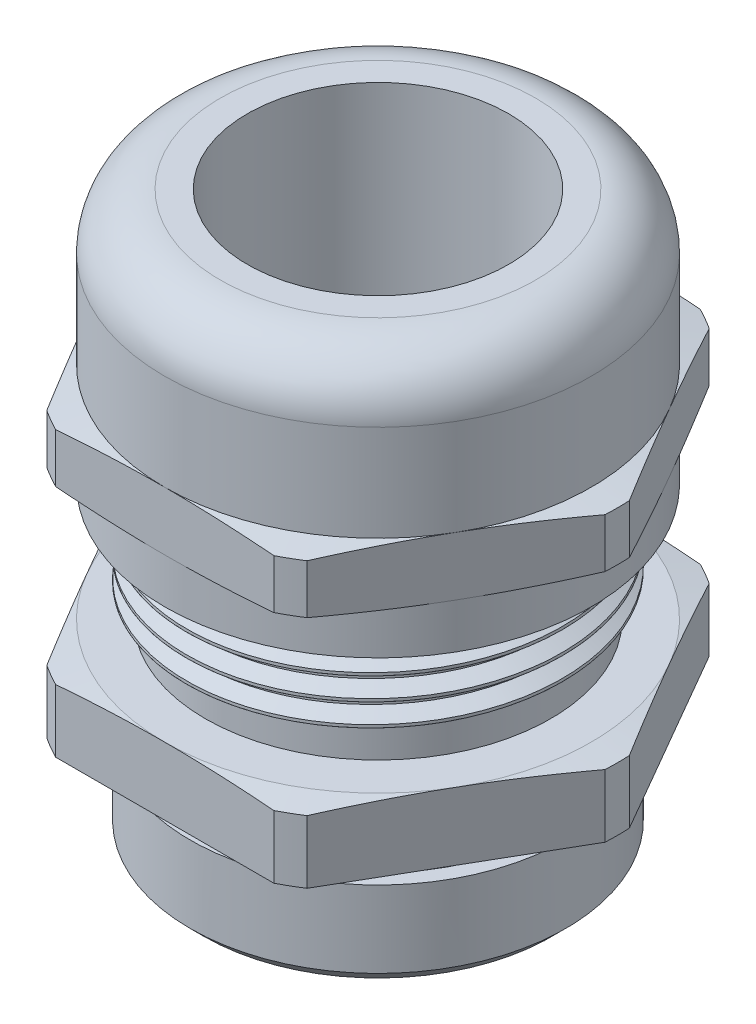
from build123d import *

# Parameters (mm, degrees)
SKETCH2_R        = 33.244454728
EXTRUDE1_DEPTH   = 44.590079147
CHAMFER2_SIZE    = 0.9
CUT_SWEEP1_PITCH = 1.5


with BuildPart() as part:
    # Sketch1 → Revolve1 (revolve)
    with BuildSketch(Plane.XY, mode=Mode.PRIVATE) as revolve1_sk:
        with BuildLine():
            Line((-8.7, 34.639140794), (-10.5, 34.639140794))
            ThreePointArc((-10.5, 34.639140794), (-13.11629509, 33.555435885), (-14.2, 30.939140794))
            Line((-14.2, 30.939140794), (-14.2, 24.539140794))
            Line((-14.2, 24.539140794), (-15.95, 24.230568578))
            Line((-15.95, 24.230568578), (-15.95, 20.947713011))
            Line((-15.95, 20.947713011), (-14.2, 20.639140794))
            Line((-14.2, 20.639140794), (-14.2, 17.639140794))
            Line((-14.2, 17.639140794), (-12.6, 17.639140794))
            Line((-12.6, 17.639140794), (-12.6, 19.639140794))
            Line((-12.6, 19.639140794), (-12.5, 19.639140794))
            Line((-12.5, 19.639140794), (-12.5, 11.839140794))
            Line((-12.5, 11.839140794), (-11.5, 11.839140794))
            Line((-11.5, 11.839140794), (-11.5, 9.839140794))
            Line((-11.5, 9.839140794), (-14.2, 9.839140794))
            Line((-14.2, 9.839140794), (-15.95, 9.530568578))
            Line((-15.95, 9.530568578), (-15.95, 5.339140794))
            Line((-15.95, 5.339140794), (-11.5, 5.339140794))
            Line((-11.5, 5.339140794), (-11.5, 3.339140794))
            Line((-11.5, 3.339140794), (-12.5, 3.339140794))
            Line((-12.5, 3.339140794), (-12.5, -2.660859206))
            Line((-12.5, -2.660859206), (-10, -2.660859206))
            Line((-10, -2.660859206), (-10, 15.039140794))
            Line((-10, 15.039140794), (-8.7, 15.039140794))
            Line((-8.7, 15.039140794), (-8.7, 34.639140794))
        make_face()
    revolve(revolve1_sk.sketch.rotate(Axis((0, 0, 0), (0, 1, 0)), 270), axis=Axis((0, 0, 0), (0, 1, 0)))

    # Sketch2 → Extrude1 (cut, through all)
    with BuildSketch(Plane(origin=(0, 34.639140794, 0), x_dir=(1, 0, 0), z_dir=(0, 1, 0))):
        Circle(SKETCH2_R)
        Polygon((-16.396747645, 0), (-8.198373822, -14.2), (8.198373822, -14.2), (16.396747645, 0), (8.198373822, 14.2), (-8.198373822, 14.2), align=None, mode=Mode.SUBTRACT)
    extrude(amount=-EXTRUDE1_DEPTH, mode=Mode.SUBTRACT)

    # Chamfer2
    chamfer2_edges = [part.edges().sort_by_distance(p)[0] for p in [
        (0, -2.660859206, 12.5),
    ]]
    chamfer(chamfer2_edges, length=CHAMFER2_SIZE)

    # Cut-Sweep1: the profile of Sketch11 screwed along a right-hand helix of 6 turns, 8 arcs to a turn; built about Z, then put on its axis
    cut_sweep1_z = Axis((0, 0, 0), (0, 0, 1))
    cut_sweep1_corners = [(11.5930896, 0.181809613, -0.519529057), (11.5930896, 0.186902044, -0.786168155), (12.4987896, 0.196886995, -1.308978953), (12.58539214, 0.197841751, -1.358969837), (12.58539214, 0.170869906, 0.053272624), (12.4987896, 0.171824662, 0.003281741)]
    with BuildLine(mode=Mode.PRIVATE) as cut_sweep1_profile:
        Line(cut_sweep1_corners[0], cut_sweep1_corners[1])
        Line(cut_sweep1_corners[1], cut_sweep1_corners[2])
        Line(cut_sweep1_corners[2], cut_sweep1_corners[3])
        Line(cut_sweep1_corners[3], cut_sweep1_corners[4])
        Line(cut_sweep1_corners[4], cut_sweep1_corners[5])
        Line(cut_sweep1_corners[5], cut_sweep1_corners[0])
    cut_sweep1_cap = Face(cut_sweep1_profile.wire())
    cut_sweep1_turn_angles = [0, 22.5, 45, 67.5, 90, 112.5, 135, 157.5, 180, 202.5, 225, 247.5, 270, 292.5, 315, 337.5, 360]
    cut_sweep1_turn_weights = [1, 0.9238795325112867, 1, 0.9238795325112867, 1, 0.9238795325112867, 1, 0.9238795325112867, 1, 0.9238795325112867, 1, 0.9238795325112867, 1, 0.9238795325112867, 1, 0.9238795325112867, 1]
    cut_sweep1_turn_rails = [Edge.make_bspline([Vector(p[0], p[1], 0).rotate(cut_sweep1_z, cut_sweep1_turn_angles[k]) / cut_sweep1_turn_weights[k] + Vector(0, 0, p[2] + CUT_SWEEP1_PITCH * cut_sweep1_turn_angles[k] / 360) for k in range(17)], [0, 0, 0, 1, 1, 2, 2, 3, 3, 4, 4, 5, 5, 6, 6, 7, 7, 8, 8, 8], 2, cut_sweep1_turn_weights) for p in cut_sweep1_corners]
    cut_sweep1_turn_sides = [Face.make_surface_from_curves(cut_sweep1_turn_rails[p[0]], cut_sweep1_turn_rails[p[1]]) for p in [(0, 1), (1, 2), (2, 3), (3, 4), (4, 5), (5, 0)]]
    cut_sweep1 = Plane(origin=(0, 11.839140794, 0), x_dir=(-1, 0, 0), z_dir=(0, 1, 0)) * Solid(Shell([*[p.moved(Location((0, 0, CUT_SWEEP1_PITCH * i))) for i in range(6) for p in cut_sweep1_turn_sides], cut_sweep1_cap, cut_sweep1_cap.rotate(cut_sweep1_z, 2160).moved(Location((0, 0, CUT_SWEEP1_PITCH * 2160 / 360)))]))
    add(cut_sweep1, mode=Mode.SUBTRACT)


solid = part.part
